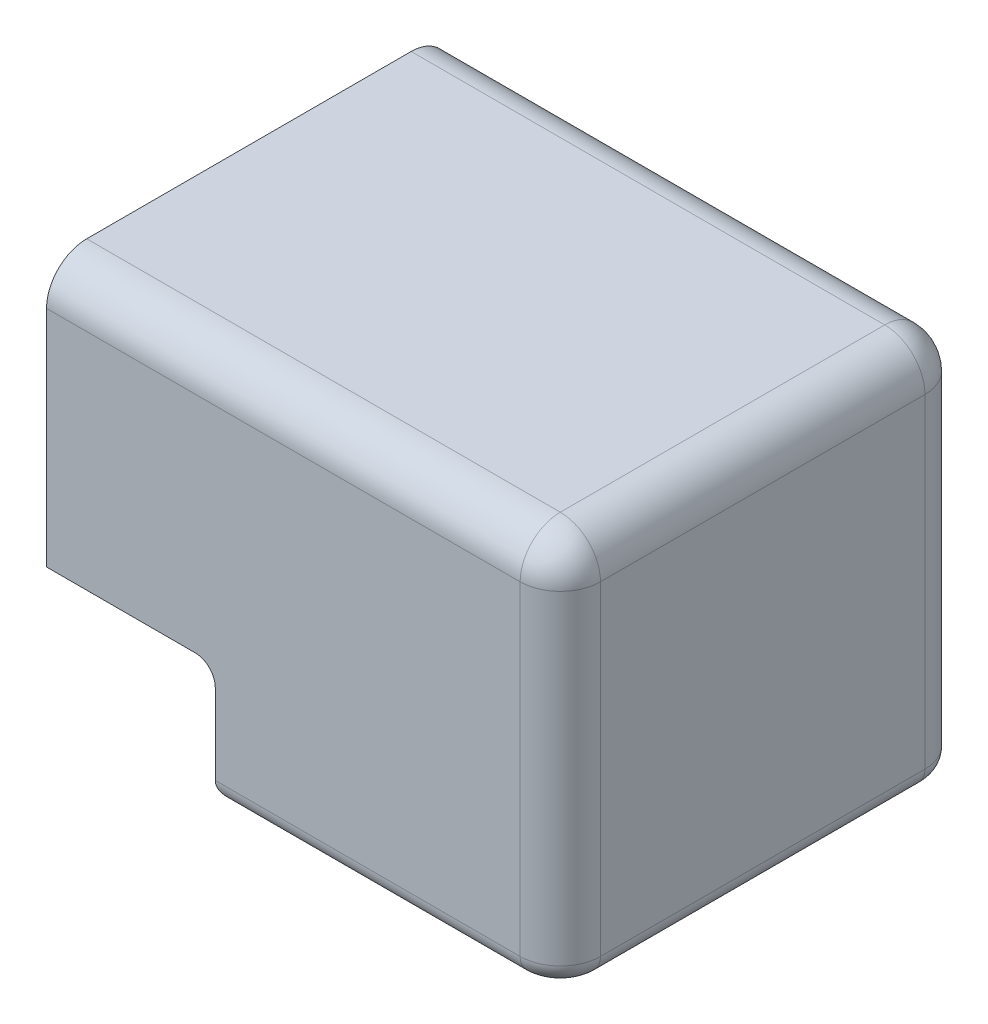
from build123d import *

# Parameters (mm, degrees)
SKETCH1_W           = 53.975
SKETCH1_H           = 31.75
BOSS_EXTRUDE1_DEPTH = 76.2
SHELL1_T            = 5
SKETCH2_W           = 44.45
SKETCH2_H           = 53.975
CUT_EXTRUDE1_DEPTH  = 5
FILLET1_R           = 31.75
FILLET2_R           = 6.35
FILLET3_R           = 6.35
SKETCH3_W           = 44.45
SKETCH3_H           = 53.975
BOSS_EXTRUDE2_DEPTH = 19.05
FILLET5_R           = 3.175
FILLET6_R           = 3.175


with BuildPart() as part:
    # Sketch1 → Boss-Extrude1 (new body)
    with BuildSketch(Plane(origin=(0, 0, 0), x_dir=(0, 0, -1), z_dir=(1, 0, 0))):
        with Locations((106.854663617, 0)):
            Rectangle(SKETCH1_W, SKETCH1_H)
    extrude(amount=BOSS_EXTRUDE1_DEPTH)

    # Shell1
    shell1_openings = [part.faces().sort_by_distance(p)[0] for p in [
        (0, 0, -106.854663617),
    ]]
    offset(amount=SHELL1_T, openings=shell1_openings, kind=Kind.INTERSECTION)

    # Sketch2 → Cut-Extrude1 (cut)
    with BuildSketch(Plane(origin=(0, -20.875, 0), x_dir=(-1, 0, 0), z_dir=(0, -1, 0))):
        with Locations((-53.975, 106.854663617)):
            Rectangle(SKETCH2_W, SKETCH2_H)
    extrude(amount=-CUT_EXTRUDE1_DEPTH, mode=Mode.SUBTRACT)

    # Fillet1
    fillet1_edges = [part.edges().sort_by_distance(p)[0] for p in [
        (76.2, 15.875, -106.854663617),
    ]]
    fillet(fillet1_edges, radius=FILLET1_R)

    # Fillet2
    # the kernel refuses this fillet: 6.35 mm, written as the material it takes off along each edge
    with BuildSketch(Plane(origin=(31.75, -15.875, -79.867163617), x_dir=(-1, 0, 0), z_dir=(0, 0, -1))) as fillet2_piece_1:
        with BuildLine():
            CenterArc((6.204836823, -6.35), FILLET2_R, 90, 77.725329785)
            Line((0, -5), (0, 0))
            Line((0, 0), (6.204836823, 0))
        make_face()
    extrude(amount=53.975, mode=Mode.SUBTRACT)

    # Fillet3
    fillet3_edges = [part.edges().sort_by_distance(p)[0] for p in [
        (81.2, 0, -138.842163617),
        (81.2, 20.875, -106.854663617),
        (81.2, 0, -74.867163617),
        (40.6, 20.875, -74.867163617),
        (40.6, 20.875, -138.842163617),
    ]]
    fillet(fillet3_edges, radius=FILLET3_R)

    # Sketch3 → Boss-Extrude2 (add)
    with BuildSketch(Plane.XZ.offset(20.875)):
        with BuildLine():
            Line((26.67, -74.867163617), (26.67, -138.842163617))
            Line((26.67, -138.842163617), (74.85, -138.842163617))
            ThreePointArc((74.85, -138.842163617), (79.340128061, -136.982291678), (81.2, -132.492163617))
            Line((81.2, -132.492163617), (81.2, -81.217163617))
            ThreePointArc((81.2, -81.217163617), (79.340128061, -76.727035557), (74.85, -74.867163617))
            Line((74.85, -74.867163617), (26.67, -74.867163617))
        make_face()
        with Locations((53.975, -106.854663617)):
            Rectangle(SKETCH3_W, SKETCH3_H, mode=Mode.SUBTRACT)
    extrude(amount=BOSS_EXTRUDE2_DEPTH)

    # Fillet5
    fillet5_edges = [part.edges().sort_by_distance(p)[0] for p in [
        (26.67, -20.875, -106.854663617),
    ]]
    fillet(fillet5_edges, radius=FILLET5_R)

    # Fillet6
    fillet6_edges = [part.edges().sort_by_distance(p)[0] for p in [
        (26.67, -39.925, -106.854663617),
        (50.76, -39.925, -138.842163617),
        (79.340128061, -39.925, -136.982291678),
        (81.2, -39.925, -106.854663617),
        (79.340128061, -39.925, -76.727035557),
        (50.76, -39.925, -74.867163617),
    ]]
    fillet(fillet6_edges, radius=FILLET6_R)


solid = part.part
